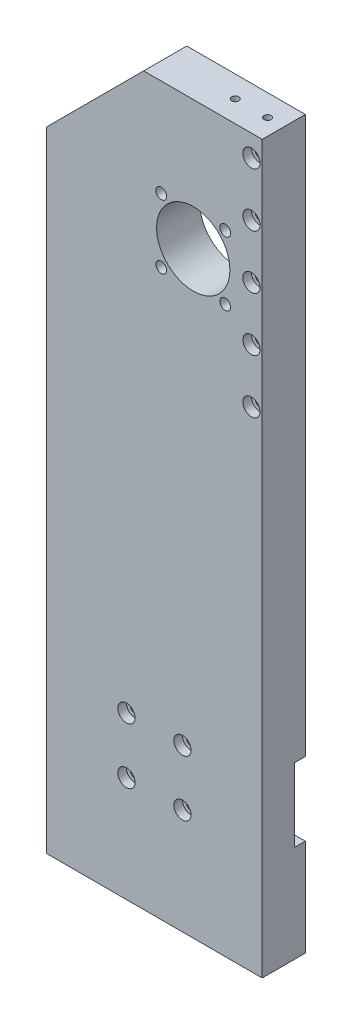
from build123d import *

# Parameters (mm, degrees)
SKETCH1_W                      = 100
SKETCH1_H                      = 337
SKETCH1_R                      = 17
SKETCH1_R_2                    = 2.5
SKETCH1_R_3                    = 2
BOSS_EXTRUDE1_DEPTH            = 20
CHAMFER1_SIZE                  = 45
SKETCH2_W                      = 100
SKETCH2_H                      = 34
CUT_EXTRUDE1_DEPTH             = 5
CBORE_FOR_M4_SHCS1_D           = 4.5
CBORE_FOR_M4_SHCS1_CBORE_D     = 8
CBORE_FOR_M4_SHCS1_CBORE_DEPTH = 4
CBORE_FOR_M4_SHCS2_D           = 4.5
CBORE_FOR_M4_SHCS2_CBORE_D     = 8
CBORE_FOR_M4_SHCS2_CBORE_DEPTH = 4
M4_TAPPED_HOLE1_D              = 3.3
M4_TAPPED_HOLE1_DEPTH          = 16.1
M4_TAPPED_HOLE1_TIP            = 0.991420021
M4_TAPPED_HOLE2_D              = 3.3
M4_TAPPED_HOLE2_DEPTH          = 15.1
M4_TAPPED_HOLE2_TIP            = 0.991420021


with BuildPart() as part:
    # Sketch1 → Boss-Extrude1 (new body)
    with BuildSketch(Plane.XY):
        with Locations((47.704546062, 452.000370419)):
            Rectangle(SKETCH1_W, SKETCH1_H)
        with Locations((65.704546062, 560.500370419)):
            Circle(SKETCH1_R, mode=Mode.SUBTRACT)
        with Locations((80.553788467, 575.349612824)):
            Circle(SKETCH1_R_2, mode=Mode.SUBTRACT)
        with Locations((80.553788467, 545.651128014)):
            Circle(SKETCH1_R_2, mode=Mode.SUBTRACT)
        with Locations((50.855303657, 545.651128014)):
            Circle(SKETCH1_R_2, mode=Mode.SUBTRACT)
        with Locations((50.855303657, 575.349612824)):
            Circle(SKETCH1_R_2, mode=Mode.SUBTRACT)
        with Locations((34.704546062, 358.500370419)):
            Circle(SKETCH1_R_3, mode=Mode.SUBTRACT)
        with Locations((60.704546062, 358.500370419)):
            Circle(SKETCH1_R_3, mode=Mode.SUBTRACT)
        with Locations((34.704546062, 332.500370419)):
            Circle(SKETCH1_R_3, mode=Mode.SUBTRACT)
        with Locations((60.704546062, 332.500370419)):
            Circle(SKETCH1_R_3, mode=Mode.SUBTRACT)
    extrude(amount=BOSS_EXTRUDE1_DEPTH)

    # Chamfer1
    chamfer1_edges = [part.edges().sort_by_distance(p)[0] for p in [
        (-2.295453938, 620.500370419, 10),
    ]]
    chamfer(chamfer1_edges, length=CHAMFER1_SIZE)

    # Sketch2 → Cut-Extrude1 (cut)
    with BuildSketch(Plane.XY):
        with Locations((47.704546062, 345.500370419)):
            Rectangle(SKETCH2_W, SKETCH2_H)
    extrude(amount=CUT_EXTRUDE1_DEPTH, mode=Mode.SUBTRACT)

    # CBORE for M4 SHCS1 (through all)
    with Locations(Plane.XY.offset(20)):
        with Locations((92.704546062, 610.500370419), (92.704546062, 585.500370419), (92.704546062, 560.500370419), (92.704546062, 535.500370419), (92.704546062, 510.500370419)):
            CounterBoreHole(CBORE_FOR_M4_SHCS1_D / 2, CBORE_FOR_M4_SHCS1_CBORE_D / 2, CBORE_FOR_M4_SHCS1_CBORE_DEPTH)

    # CBORE for M4 SHCS2 (through all)
    with Locations(Plane(origin=(34.704546062, 358.500370419, 20), x_dir=(1, 0, 0), z_dir=(0, 0, 1))):
        with Locations((0, 0), (26, 0), (0, -26), (26, -26)):
            CounterBoreHole(CBORE_FOR_M4_SHCS2_D / 2, CBORE_FOR_M4_SHCS2_CBORE_D / 2, CBORE_FOR_M4_SHCS2_CBORE_DEPTH)

    # M4 Tapped Hole1
    with Locations(Plane(origin=(7.704546062, 283.500370419, 10), x_dir=(0, 0, -1), z_dir=(0, -1, 0))):
        with Locations((0, 0), (0, 20), (0, 60), (0, 80)):
            Hole(M4_TAPPED_HOLE1_D / 2, depth=M4_TAPPED_HOLE1_DEPTH)
            with Locations((0, 0, -(M4_TAPPED_HOLE1_DEPTH + M4_TAPPED_HOLE1_TIP / 2))):  # 118° drill point
                Cone(0, M4_TAPPED_HOLE1_D / 2, M4_TAPPED_HOLE1_TIP, mode=Mode.SUBTRACT)

    # M4 Tapped Hole2
    with Locations(Plane(origin=(90.204546062, 625.500370419, 10), x_dir=(0, 0, 1), z_dir=(0, 1, 0))):
        with Locations((0, 0), (0, -15)):
            Hole(M4_TAPPED_HOLE2_D / 2, depth=M4_TAPPED_HOLE2_DEPTH)
            with Locations((0, 0, -(M4_TAPPED_HOLE2_DEPTH + M4_TAPPED_HOLE2_TIP / 2))):  # 118° drill point
                Cone(0, M4_TAPPED_HOLE2_D / 2, M4_TAPPED_HOLE2_TIP, mode=Mode.SUBTRACT)


solid = part.part
